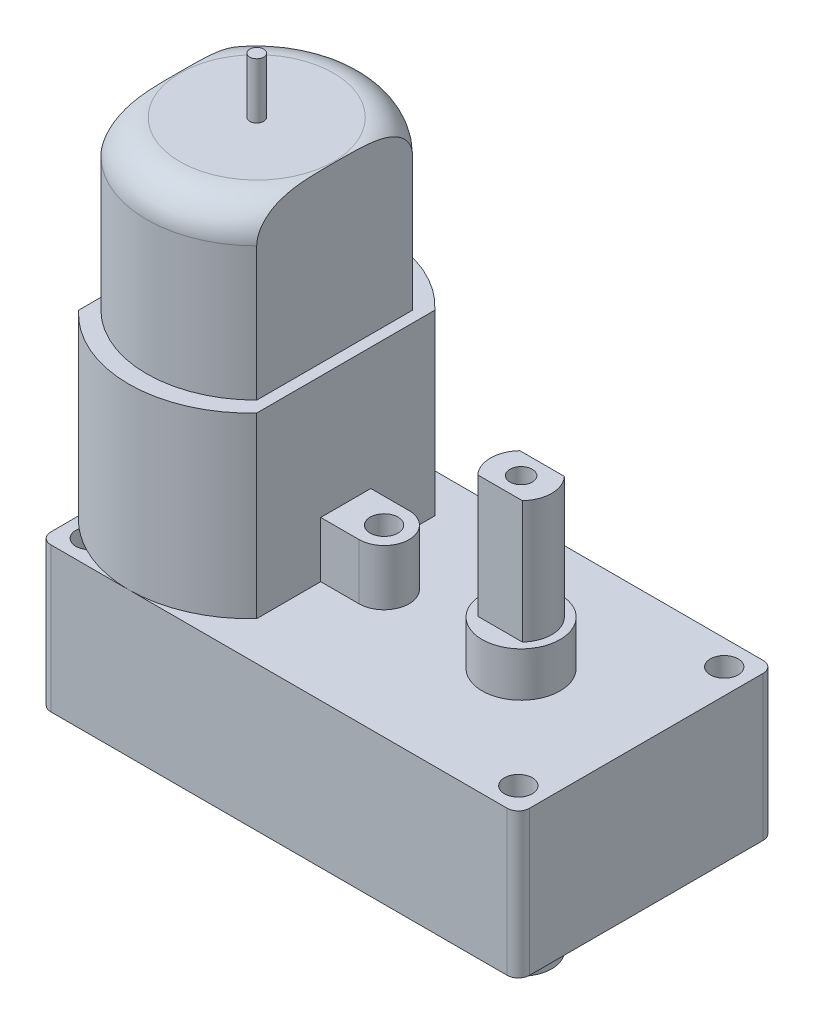
from build123d import *

# Parameters (mm, degrees)
SKETCH2_W            = 43
SKETCH2_H            = 23
SKETCH2_R            = 1.25
BOSS_EXTRUDE1_DEPTH  = 13
FILLET1_R            = 1
BOSS_EXTRUDE2_DEPTH  = 16
BOSS_EXTRUDE3_DEPTH  = 15
SKETCH5_R            = 0.625
BOSS_EXTRUDE4_DEPTH  = 5
FILLET2_R            = 3
SKETCH6_R            = 3.5
BOSS_EXTRUDE5_DEPTH  = 4
SKETCH7_R            = 1
BOSS_EXTRUDE7_DEPTH  = 11
SKETCH8_R            = 1.25
BOSS_EXTRUDE8_DEPTH  = 5
BOSS_EXTRUDE9_START  = 9
BOSS_EXTRUDE9_DEPTH  = 9
SKETCH10_R           = 2
BOSS_EXTRUDE10_DEPTH = 2


with BuildPart() as part:
    # Sketch2 → Boss-Extrude1 (new body)
    with BuildSketch(Plane(origin=(0, 0, 0), x_dir=(1, 0, 0), z_dir=(0, 1, 0))):
        with Locations((21.5, 11.5)):
            Rectangle(SKETCH2_W, SKETCH2_H)
        with Locations(Location((2.25, 20.75, 0), (0, 0, 90))):
            Circle(SKETCH2_R, mode=Mode.SUBTRACT)
        with Locations(Location((40.75, 20.75, 0), (0, 0, 90))):
            Circle(SKETCH2_R, mode=Mode.SUBTRACT)
        with Locations(Location((40.75, 2.25, 0), (0, 0, 90))):
            Circle(SKETCH2_R, mode=Mode.SUBTRACT)
        with Locations(Location((2.25, 2.25, 0), (0, 0, 90))):
            Circle(SKETCH2_R, mode=Mode.SUBTRACT)
    extrude(amount=BOSS_EXTRUDE1_DEPTH)

    # Fillet1
    fillet1_edges = [part.edges().sort_by_distance(p)[0] for p in [
        (0, 6.5, -23),
        (43, 6.5, -23),
        (43, 6.5, 0),
        (0, 6.5, 0),
    ]]
    fillet(fillet1_edges, radius=FILLET1_R)

    # Sketch3 → Boss-Extrude2 (add)
    with BuildSketch(Plane(origin=(0, 13, 0), x_dir=(1, 0, 0), z_dir=(0, 1, 0))):
        with BuildLine():
            Line((16, 19.5), (16, 3.5))
            ThreePointArc((16, 3.5), (8, 0), (0, 3.5))
            Line((0, 3.5), (0, 19.5))
            ThreePointArc((0, 19.5), (8, 23), (16, 19.5))
        make_face()
    extrude(amount=BOSS_EXTRUDE2_DEPTH)

    # Sketch4 → Boss-Extrude3 (add)
    with BuildSketch(Plane(origin=(0, 29, 0), x_dir=(1, 0, 0), z_dir=(0, 1, 0))):
        with BuildLine():
            Line((1, 18.5), (1, 4.5))
            ThreePointArc((1, 4.5), (8, 1.600505063), (15, 4.5))
            Line((15, 4.5), (15, 18.5))
            ThreePointArc((15, 18.5), (8, 21.399494937), (1, 18.5))
        make_face()
    extrude(amount=BOSS_EXTRUDE3_DEPTH)

    # Sketch5 → Boss-Extrude4 (add)
    with BuildSketch(Plane(origin=(0, 44, 0), x_dir=(1, 0, 0), z_dir=(0, 1, 0))):
        with Locations(Location((8, 11.5, 0), (0, 0, 90))):
            Circle(SKETCH5_R)
    extrude(amount=BOSS_EXTRUDE4_DEPTH)

    # Fillet2
    # the kernel refuses this fillet: 3 mm, written as the material it takes off along each edge
    with BuildSketch(Plane(origin=(8, 44, -11.5), x_dir=(0.5117233691003439, 0, 0.8591502741177431), z_dir=(-0.8591502741177431, 0, 0.5117233691003439))) as fillet2_piece_1:
        with BuildLine():
            CenterArc((9.899494937 - FILLET2_R, -FILLET2_R), FILLET2_R, 0, 90)
            Line((9.899494937 - FILLET2_R, 0), (9.899494937 - FILLET2_R, FILLET2_R * 0.02))
            Line((9.899494937 - FILLET2_R, FILLET2_R * 0.02), (9.899494937 + FILLET2_R * 0.02, FILLET2_R * 0.02))
            Line((9.899494937 + FILLET2_R * 0.02, FILLET2_R * 0.02), (9.899494937 + FILLET2_R * 0.02, -FILLET2_R))
            Line((9.899494937 + FILLET2_R * 0.02, -FILLET2_R), (9.899494937, -FILLET2_R))
        make_face()
    revolve(axis=Axis((8, 44, -11.5), (0, 1, 0)), revolution_arc=298.442618359, mode=Mode.SUBTRACT)
    with BuildSketch(Plane(origin=(8, 44, -11.5), x_dir=(-0.5117233691003458, 0, -0.859150274117742), z_dir=(0.859150274117742, 0, -0.5117233691003458))) as fillet2_piece_2:
        with BuildLine():
            CenterArc((9.899494937 - FILLET2_R, -FILLET2_R), FILLET2_R, 0, 90)
            Line((9.899494937 - FILLET2_R, 0), (9.899494937 - FILLET2_R, FILLET2_R * 0.02))
            Line((9.899494937 - FILLET2_R, FILLET2_R * 0.02), (9.899494937 + FILLET2_R * 0.02, FILLET2_R * 0.02))
            Line((9.899494937 + FILLET2_R * 0.02, FILLET2_R * 0.02), (9.899494937 + FILLET2_R * 0.02, -FILLET2_R))
            Line((9.899494937 + FILLET2_R * 0.02, -FILLET2_R), (9.899494937, -FILLET2_R))
        make_face()
    revolve(axis=Axis((8, 44, -11.5), (0, 1, 0)), revolution_arc=298.442618359, mode=Mode.SUBTRACT)

    # Sketch6 → Boss-Extrude5 (add)
    with BuildSketch(Plane(origin=(0, 13, 0), x_dir=(1, 0, 0), z_dir=(0, 1, 0))):
        with Locations(Location((31.75, 11.5, 0), (0, 0, 90))):
            Circle(SKETCH6_R)
    extrude(amount=BOSS_EXTRUDE5_DEPTH)

    # Sketch7 → Boss-Extrude7 (add)
    with BuildSketch(Plane(origin=(0, 17, 0), x_dir=(1, 0, 0), z_dir=(0, 1, 0))):
        with BuildLine():
            Line((29.75, 13.387458609), (33.75, 13.387458609))
            ThreePointArc((33.75, 13.387458609), (34.5, 11.5), (33.75, 9.612541391))
            Line((33.75, 9.612541391), (29.75, 9.612541391))
            ThreePointArc((29.75, 9.612541391), (29, 11.5), (29.75, 13.387458609))
        make_face()
        with Locations(Location((31.75, 11.5, 0), (0, 0, 270))):
            Circle(SKETCH7_R, mode=Mode.SUBTRACT)
    extrude(amount=BOSS_EXTRUDE7_DEPTH)

    # Sketch8 → Boss-Extrude8 (add)
    # profile 1 of 2: a face of its own
    with BuildSketch(Plane(origin=(0, 13, 0), x_dir=(1, 0, 0), z_dir=(0, 1, 0))):
        with BuildLine():
            Line((-3.437113108, 13.75), (0, 13.75))
            Line((0, 13.75), (0, 9.25))
            Line((0, 9.25), (-3.437113108, 9.25))
            ThreePointArc((-3.437113108, 9.25), (-5.687113108, 11.5), (-3.437113108, 13.75))
        make_face()
        with Locations(Location((-3.437113108, 11.5, 0), (0, 0, 270))):
            Circle(SKETCH8_R, mode=Mode.SUBTRACT)
    # profile 2 of 2: a face of its own
    with BuildSketch(Plane(origin=(0, 13, 0), x_dir=(1, 0, 0), z_dir=(0, 1, 0))):
        with BuildLine():
            Line((16, 9.25), (19.44, 9.25))
            ThreePointArc((19.44, 9.25), (21.69, 11.5), (19.44, 13.75))
            Line((19.44, 13.75), (16, 13.75))
            Line((16, 13.75), (16, 9.25))
        make_face()
        with Locations(Location((19.44, 11.5, 0), (0, 0, 270))):
            Circle(SKETCH8_R, mode=Mode.SUBTRACT)
    extrude(amount=BOSS_EXTRUDE8_DEPTH)

    # Sketch9 → Boss-Extrude9 (add)
    with BuildSketch(Plane.XZ.offset(BOSS_EXTRUDE9_START)):
        with BuildLine():
            Line((33.75, -13.387458609), (29.75, -13.387458609))
            ThreePointArc((29.75, -13.387458609), (29, -11.5), (29.75, -9.612541391))
            Line((29.75, -9.612541391), (33.75, -9.612541391))
            ThreePointArc((33.75, -9.612541391), (34.5, -11.5), (33.75, -13.387458609))
        make_face()
    extrude(amount=-BOSS_EXTRUDE9_DEPTH)

    # Sketch10 → Boss-Extrude10 (add)
    with BuildSketch(Plane.XZ):
        with Locations(Location((20.75, -11.5, 0), (0, 0, 270))):
            Circle(SKETCH10_R)
    extrude(amount=BOSS_EXTRUDE10_DEPTH)


solid = part.part
